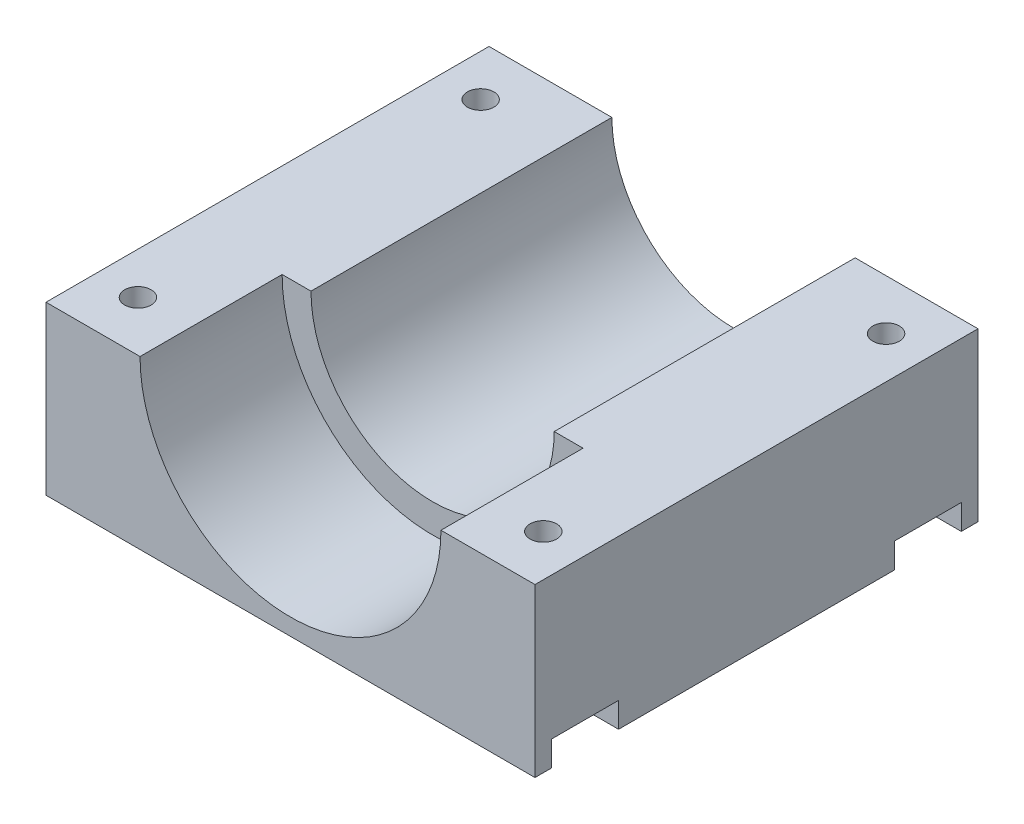
from build123d import *

# Parameters (mm, degrees)
SKETCH1_W                                  = 58.5
SKETCH1_H                                  = 20
BOSS_EXTRUDE1_DEPTH                        = 53
CUT_EXTRUDE2_DEPTH                         = 17
CUT_EXTRUDE3_DEPTH                         = 42.5
SKETCH8_W                                  = 10
SKETCH8_H                                  = 8
CUT_EXTRUDE6_DEPTH                         = 3
SKETCH7_R                                  = 1.585
CUT_EXTRUDE5_DEPTH                         = 92.5
MIRROR1_AT_THE_SECOND_PLANE_COPY_1_SKETC_W = 10
MIRROR1_AT_THE_SECOND_PLANE_COPY_1_SKETC_H = 8
MIRROR1_AT_THE_SECOND_PLANE_COPY_1_DEPTH   = 3


with BuildPart() as part:
    # Sketch1 → Boss-Extrude1 (new body)
    with BuildSketch(Plane.XY):
        with Locations((29.25, -3.609195402)):
            Rectangle(SKETCH1_W, SKETCH1_H)
    extrude(amount=BOSS_EXTRUDE1_DEPTH)

    # Sketch3 → Cut-Extrude2 (cut)
    with BuildSketch(Plane.XY.offset(53)):
        with BuildLine():
            Line((11.25, 6.390804598), (47.25, 6.390804598))
            ThreePointArc((47.25, 6.390804598), (29.25, -11.609195402), (11.25, 6.390804598))
        make_face()
    extrude(amount=-CUT_EXTRUDE2_DEPTH, mode=Mode.SUBTRACT)

    # Sketch5 → Cut-Extrude3 (cut)
    with BuildSketch(Plane(origin=(0, 0, 0), x_dir=(-1, 0, 0), z_dir=(0, 0, -1))):
        with BuildLine():
            Line((-43.8, 6.390804598), (-14.7, 6.390804598))
            ThreePointArc((-14.7, 6.390804598), (-29.25, -8.159195402), (-43.8, 6.390804598))
        make_face()
    extrude(amount=-CUT_EXTRUDE3_DEPTH, mode=Mode.SUBTRACT)

    # Sketch8 → Cut-Extrude6 (cut)
    with BuildSketch(Plane(origin=(0, -13.609195402, 0), x_dir=(-1, 0, 0), z_dir=(0, -1, 0))):
        with Locations((-53.5, -6)):
            Rectangle(SKETCH8_W, SKETCH8_H)
    cut_extrude6 = extrude(amount=-CUT_EXTRUDE6_DEPTH, mode=Mode.SUBTRACT)

    # Sketch7 → Cut-Extrude5 (cut)
    with BuildSketch(Plane(origin=(0, -13.609195402, 0), x_dir=(-1, 0, 0), z_dir=(0, -1, 0))):
        with Locations((-53.5, -47)):
            Circle(SKETCH7_R)
        with Locations((-53.5, -6)):
            Circle(SKETCH7_R)
        with Locations((-5, -6)):
            Circle(SKETCH7_R)
        with Locations((-5, -47)):
            Circle(SKETCH7_R)
    extrude(amount=-CUT_EXTRUDE5_DEPTH, mode=Mode.SUBTRACT)

    # Mirror1: Cut-Extrude6 across plane
    add(cut_extrude6.mirror(Plane.XY.offset(26.5)), mode=Mode.SUBTRACT)

    # Mirror1 at the second plane: Cut-Extrude6 across plane
    add(cut_extrude6.mirror(Plane.ZY.offset(-29.25)), mode=Mode.SUBTRACT)

    # Mirror1 at the second plane copy 1 sketc → Mirror1 at the second plane copy 1 (cut)
    with BuildSketch(Plane(origin=(58.5, -13.609195402, 53), x_dir=(1, 0, 0), z_dir=(0, -1, 0))):
        with Locations((-53.5, -6)):
            Rectangle(MIRROR1_AT_THE_SECOND_PLANE_COPY_1_SKETC_W, MIRROR1_AT_THE_SECOND_PLANE_COPY_1_SKETC_H)
    extrude(amount=-MIRROR1_AT_THE_SECOND_PLANE_COPY_1_DEPTH, mode=Mode.SUBTRACT)


solid = part.part
